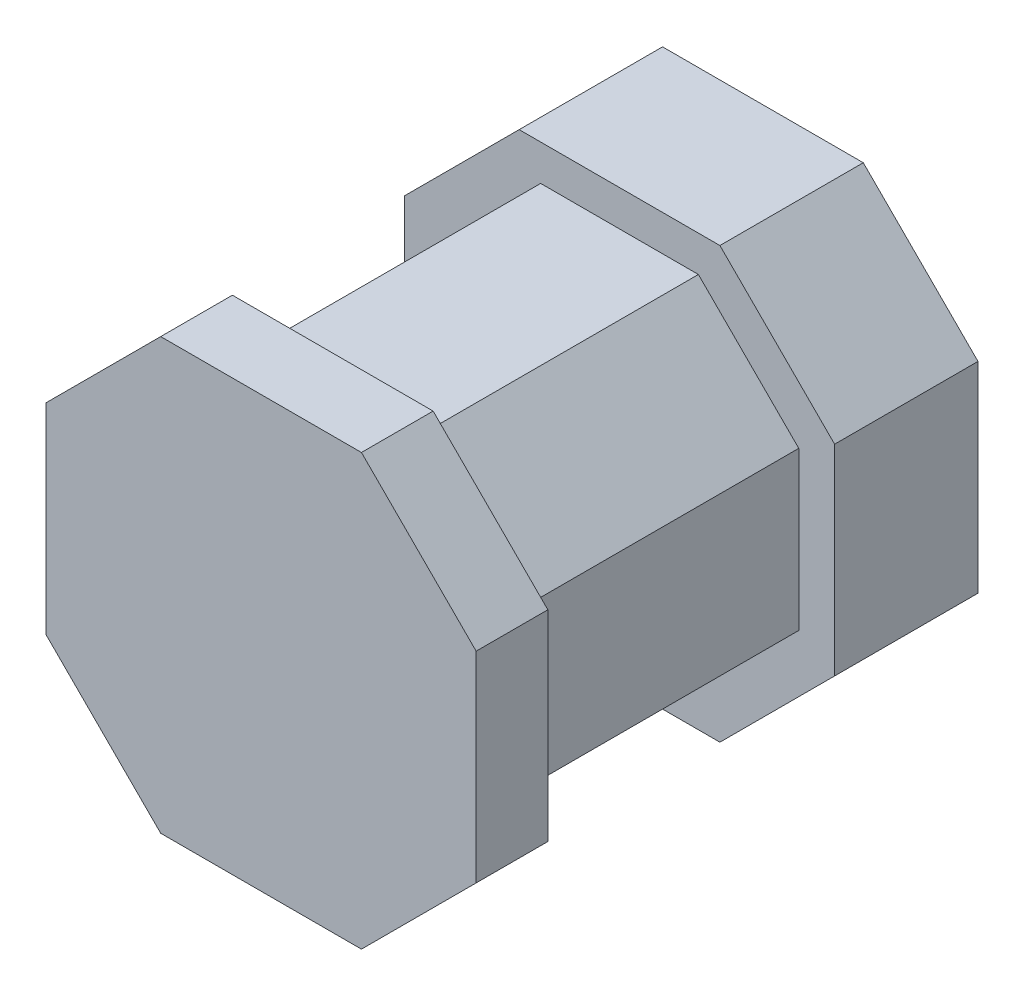
from build123d import *

# Parameters (mm, degrees)
EXTRUDE_1_DEPTH     = 10
SKETCH_2_W          = 2
SKETCH_2_H          = 5
CUT_EXTRUDE_1_DEPTH = 10
EXTRUDE_2_DEPTH     = 20
EXTRUDE_3_DEPTH     = 5


with BuildPart() as part:
    # 草图1 → 凸台-拉伸1 (new body)
    with BuildSketch(Plane.XY):
        Polygon((-15, 7), (-7, 15), (7, 15), (15, 7), (15, -7), (7, -15), (-7, -15), (-15, -7), align=None)
    extrude(amount=EXTRUDE_1_DEPTH)

    # 草图2 → 切除-拉伸1 (cut)
    with BuildSketch(Plane(origin=(0, 0, 0), x_dir=(-1, 0, 0), z_dir=(0, 0, -1))):
        with Locations((-5.553463203, 5.820508059)):
            Rectangle(SKETCH_2_W, SKETCH_2_H)
        with Locations((5.553463203, 5.820508059)):
            Rectangle(SKETCH_2_W, SKETCH_2_H)
        with Locations((5.553463203, -5.820508059)):
            Rectangle(SKETCH_2_W, SKETCH_2_H)
        with Locations((-5.553463203, -5.820508059)):
            Rectangle(SKETCH_2_W, SKETCH_2_H)
    extrude(amount=-CUT_EXTRUDE_1_DEPTH, mode=Mode.SUBTRACT)

    # 草图3 → 凸台-拉伸2 (add)
    with BuildSketch(Plane.XY.offset(10)):
        Polygon((-12.5, 5.5), (-5.5, 12.5), (5.5, 12.5), (12.5, 5.5), (12.5, -5.5), (5.5, -12.5), (-5.5, -12.5), (-12.5, -5.5), align=None)
    extrude(amount=EXTRUDE_2_DEPTH)

    # 草图4 → 凸台-拉伸3 (add)
    with BuildSketch(Plane.XY.offset(30)):
        Polygon((-15, 7), (-7, 15), (7, 15), (15, 7), (15, -7), (7, -15), (-7, -15), (-15, -7), align=None)
    extrude(amount=EXTRUDE_3_DEPTH)


solid = part.part
